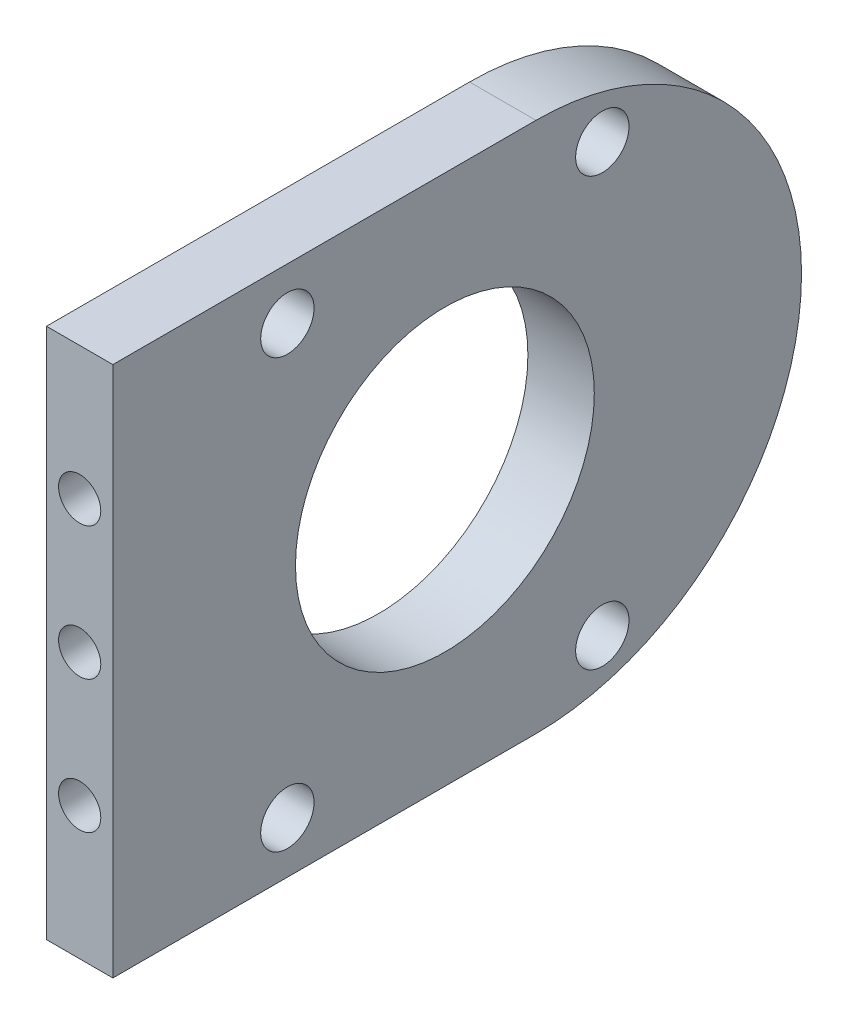
from build123d import *

# Parameters (mm, degrees)
SKETCH2_W                  = 76.2
SKETCH2_H                  = 50.8
BOSS_EXTRUDE2_DEPTH        = 6.35
F_10_32_TAPPED_HOLE1_D     = 4.0386
F_10_32_TAPPED_HOLE1_DEPTH = 12.02944
F_10_32_TAPPED_HOLE1_TIP   = 1.213317848
SKETCH6_R                  = 14.2875
CUT_EXTRUDE1_DEPTH         = 47.228697797
F_10_CLEARANCE_HOLE1_D     = 5.1054
SKETCH13_W                 = 10.345899722
SKETCH13_H                 = 50.8
CUT_EXTRUDE2_DEPTH         = 47.228697797
FILLET3_R                  = 25.4


with BuildPart() as part:
    # Sketch2 → Boss-Extrude2 (new body)
    with BuildSketch(Plane(origin=(0, 0, 0), x_dir=(0, 0, -1), z_dir=(1, 0, 0))):
        Rectangle(SKETCH2_W, SKETCH2_H)
    extrude(amount=BOSS_EXTRUDE2_DEPTH)

    # #10-32 Tapped Hole1
    with Locations(Plane.XY.offset(38.1)):
        with Locations((3.175, -12.7), (3.175, 0), (3.175, 12.7)):
            Hole(F_10_32_TAPPED_HOLE1_D / 2, depth=F_10_32_TAPPED_HOLE1_DEPTH)
            with Locations((0, 0, -(F_10_32_TAPPED_HOLE1_DEPTH + F_10_32_TAPPED_HOLE1_TIP / 2))):  # 118° drill point
                Cone(0, F_10_32_TAPPED_HOLE1_D / 2, F_10_32_TAPPED_HOLE1_TIP, mode=Mode.SUBTRACT)

    # Sketch6 → Cut-Extrude1 (cut, through all)
    with BuildSketch(Plane(origin=(6.35, 0, 0), x_dir=(0, 0, -1), z_dir=(1, 0, 0))):
        with Locations((-6.35, 0)):
            Circle(SKETCH6_R)
    extrude(amount=-CUT_EXTRUDE1_DEPTH, mode=Mode.SUBTRACT)

    # #10 Clearance Hole1 (through all)
    with Locations(Plane.ZY):
        with Locations((-8.704100278, -20.440822776), (21.413163559, 20.468716687), (21.413163559, -20.468716687), (-8.704100278, 20.440822776)):
            Hole(F_10_CLEARANCE_HOLE1_D / 2)

    # Sketch13 → Cut-Extrude2 (cut, through all)
    with BuildSketch(Plane(origin=(6.35, 0, 0), x_dir=(0, 0, -1), z_dir=(1, 0, 0))):
        with Locations((32.927050139, 0)):
            Rectangle(SKETCH13_W, SKETCH13_H)
    extrude(amount=-CUT_EXTRUDE2_DEPTH, mode=Mode.SUBTRACT)

    # Fillet3
    fillet3_edges = [part.edges().sort_by_distance(p)[0] for p in [
        (3.175, 25.4, -27.754100278),
        (3.175, -25.4, -27.754100278),
    ]]
    fillet(fillet3_edges, radius=FILLET3_R - 0.0001)  # a hair under: the kernel refuses the full size


solid = part.part
